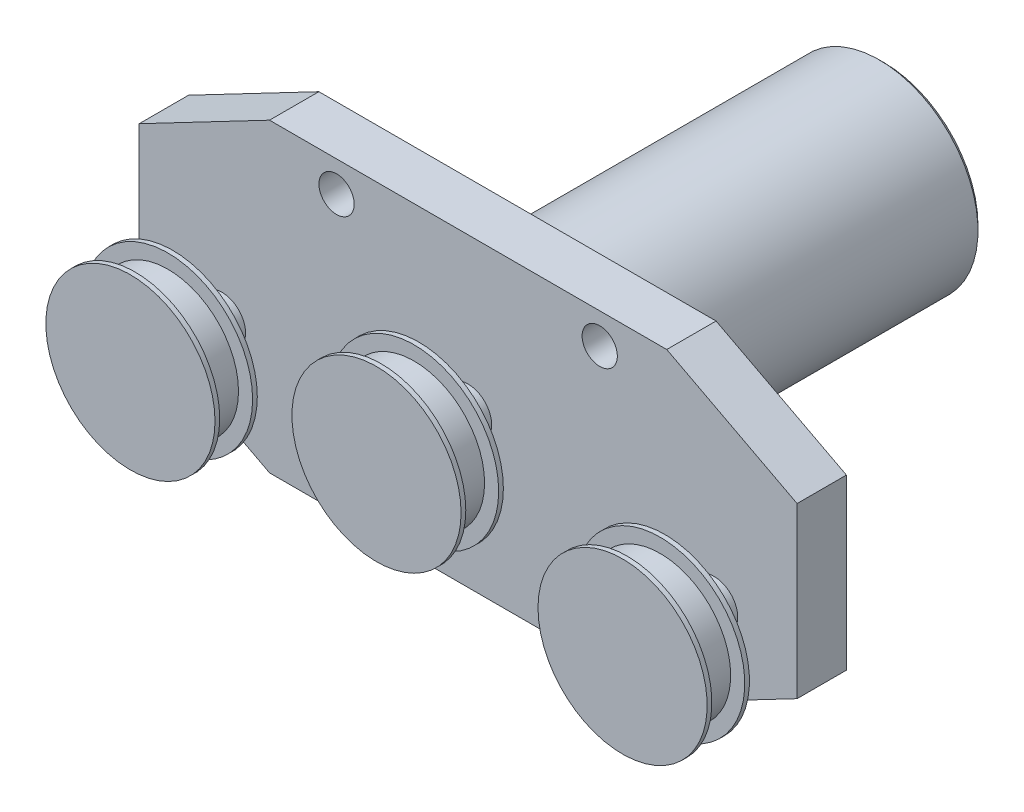
from build123d import *

# Parameters (mm, degrees)
SKETCH1_R           = 2.25
BOSS_EXTRUDE1_DEPTH = 10.5
SKETCH3_R           = 5
BOSS_EXTRUDE2_DEPTH = 10.5
SKETCH4_R           = 3.75
CUT_EXTRUDE1_DEPTH  = 6
SKETCH5_R           = 18
BOSS_EXTRUDE3_DEPTH = 9
SKETCH7_W           = 167.229187533
SKETCH7_H           = 99.836007657
SKETCH7_R           = 15
CUT_EXTRUDE2_DEPTH  = 7
SKETCH8_R           = 21
BOSS_EXTRUDE4_DEPTH = 78
CHAMFER1_SIZE       = 1


with BuildPart() as part:
    # Sketch1 → Boss-Extrude1 (new body)
    with BuildSketch(Plane.XY):
        Polygon((-21.132163801, 32.5), (-48.867836199, 17.981913686), (-48.867836199, -17.981913686), (-21.132163801, -32.5), (21.132163801, -32.5), (21.132163801, 32.5), align=None)
        with Locations((-6.867836199, 26)):
            Circle(SKETCH1_R, mode=Mode.SUBTRACT)
        with Locations((-6.867836199, -26)):
            Circle(SKETCH1_R, mode=Mode.SUBTRACT)
    boss_extrude1 = extrude(amount=BOSS_EXTRUDE1_DEPTH)

    # Mirror1: Boss-Extrude1 across plane
    add(boss_extrude1.mirror(Plane(origin=(21.132163801, 0, 10.5), x_dir=(0, 0, 1), z_dir=(1, 0, 0))))

    # Sketch3 → Boss-Extrude2 (add)
    with BuildSketch(Plane.XY.offset(10.5)):
        with Locations((21.132163801, 0)):
            Circle(SKETCH3_R)
        with Locations((-31.232914097, -9.276373518)):
            Circle(SKETCH3_R)
        with Locations((73.4972417, -9.276373518)):
            Circle(SKETCH3_R)
    extrude(amount=BOSS_EXTRUDE2_DEPTH)

    # Sketch4 → Cut-Extrude1 (cut)
    with BuildSketch(Plane.XY.offset(10.5)):
        with Locations((-6.867836199, -26)):
            Circle(SKETCH4_R)
        with Locations((-6.867836199, 26)):
            Circle(SKETCH4_R)
        with Locations((49.132163801, 26)):
            Circle(SKETCH4_R)
        with Locations((49.132163801, -26)):
            Circle(SKETCH4_R)
    extrude(amount=-CUT_EXTRUDE1_DEPTH, mode=Mode.SUBTRACT)

    # Sketch5 → Boss-Extrude3 (add)
    with BuildSketch(Plane.XY.offset(21)):
        with Locations((21.132163801, 0)):
            Circle(SKETCH5_R)
        with Locations((-31.232914097, -9.276373518)):
            Circle(SKETCH5_R)
    extrude(amount=BOSS_EXTRUDE3_DEPTH)

    # Sketch7 → Cut-Extrude2 (cut)
    with BuildSketch(Plane.XY.offset(29)):
        with Locations((-31.232914097, -9.276373518)):
            Rectangle(SKETCH7_W, SKETCH7_H)
        with Locations((-31.232914097, -9.276373518)):
            Circle(SKETCH7_R, mode=Mode.SUBTRACT)
        with Locations((21.132163801, 0)):
            Circle(SKETCH7_R, mode=Mode.SUBTRACT)
    extrude(amount=-CUT_EXTRUDE2_DEPTH, mode=Mode.SUBTRACT)

    # Mirror2: part across plane


with BuildPart() as part_1:
    add(part.part)
    add(part.part.mirror(Plane(origin=(21.132163801, 0, 0), x_dir=(0, 0, 1), z_dir=(1, 0, 0))))

    # Sketch8 → Boss-Extrude4 (add)
    with BuildSketch(Plane(origin=(0, 0, 0), x_dir=(-1, 0, 0), z_dir=(0, 0, -1))):
        with Locations((-21.132163801, 0)):
            Circle(SKETCH8_R)
    extrude(amount=BOSS_EXTRUDE4_DEPTH)

    # Chamfer1
    chamfer1_edges = [part_1.edges().sort_by_distance(p)[0] for p in [
        (42.132163801, 0, -78),
    ]]
    chamfer(chamfer1_edges, length=CHAMFER1_SIZE)


solid = part_1.part
